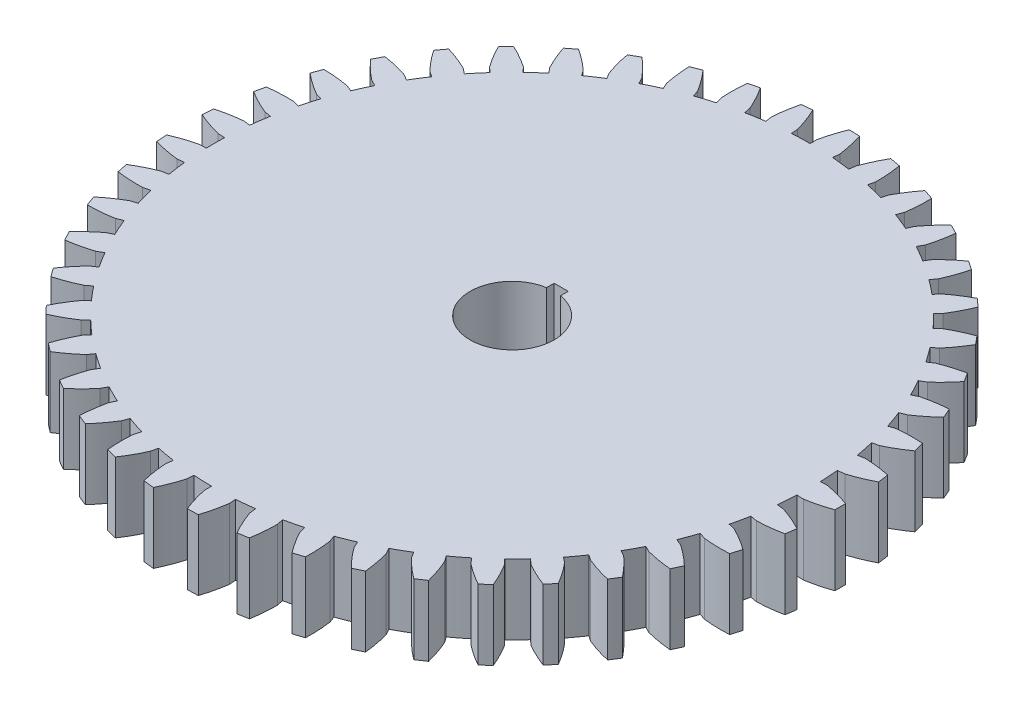
from build123d import *

# Parameters (mm, degrees)
BOSS_EXTRUDE1_DEPTH = 5
CIRPATTERN4_COUNT   = 45
SKETCH6_R           = 21.25
BOSS_EXTRUDE2_DEPTH = 5
SKETCH7_R           = 3
SKETCH7_W           = 1
SKETCH7_H           = 1
CUT_EXTRUDE1_DEPTH  = 34.606348303


with BuildPart() as part:
    # Sketch3 → Boss-Extrude1 (new body)
    with BuildSketch(Plane(origin=(0, 0, 0), x_dir=(1, 0, 0), z_dir=(0, 1, 0))):
        with BuildLine():
            Line((1.703017345, 21.666504385), (1.665143664, 21.184659463))
            ThreePointArc((1.665143664, 21.184659463), (0.833212579, 21.233658582), (0, 21.25))
            Line((0, 21.25), (0, 21.733331092))
            ThreePointArc((0, 21.733331092), (0.231941932, 22.625135128), (0.539377818, 23.493809218))
            ThreePointArc((0.539377818, 23.493809218), (0.921435088, 23.481928315), (1.303248573, 23.463834792))
            ThreePointArc((1.303248573, 23.463834792), (1.541670098, 22.573741159), (1.703017345, 21.666504385))
        make_face()
    extrude(amount=BOSS_EXTRUDE1_DEPTH)


with BuildPart() as cirpattern4_1:
    # CirPattern4: pattern copy
    add(part.part.rotate(Axis((0, 0, 0), (0, 1, 0)), 1 * 360 / CIRPATTERN4_COUNT))


with BuildPart() as cirpattern4_2:
    # CirPattern4: pattern copy
    add(part.part.rotate(Axis((0, 0, 0), (0, 1, 0)), 2 * 360 / CIRPATTERN4_COUNT))


with BuildPart() as cirpattern4_3:
    # CirPattern4: pattern copy
    add(part.part.rotate(Axis((0, 0, 0), (0, 1, 0)), 3 * 360 / CIRPATTERN4_COUNT))


with BuildPart() as cirpattern4_4:
    # CirPattern4: pattern copy
    add(part.part.rotate(Axis((0, 0, 0), (0, 1, 0)), 4 * 360 / CIRPATTERN4_COUNT))


with BuildPart() as cirpattern4_5:
    # CirPattern4: pattern copy
    add(part.part.rotate(Axis((0, 0, 0), (0, 1, 0)), 5 * 360 / CIRPATTERN4_COUNT))


with BuildPart() as cirpattern4_6:
    # CirPattern4: pattern copy
    add(part.part.rotate(Axis((0, 0, 0), (0, 1, 0)), 6 * 360 / CIRPATTERN4_COUNT))


with BuildPart() as cirpattern4_7:
    # CirPattern4: pattern copy
    add(part.part.rotate(Axis((0, 0, 0), (0, 1, 0)), 7 * 360 / CIRPATTERN4_COUNT))


with BuildPart() as cirpattern4_8:
    # CirPattern4: pattern copy
    add(part.part.rotate(Axis((0, 0, 0), (0, 1, 0)), 8 * 360 / CIRPATTERN4_COUNT))


with BuildPart() as cirpattern4_9:
    # CirPattern4: pattern copy
    add(part.part.rotate(Axis((0, 0, 0), (0, 1, 0)), 9 * 360 / CIRPATTERN4_COUNT))


with BuildPart() as cirpattern4_10:
    # CirPattern4: pattern copy
    add(part.part.rotate(Axis((0, 0, 0), (0, 1, 0)), 10 * 360 / CIRPATTERN4_COUNT))


with BuildPart() as cirpattern4_11:
    # CirPattern4: pattern copy
    add(part.part.rotate(Axis((0, 0, 0), (0, 1, 0)), 11 * 360 / CIRPATTERN4_COUNT))


with BuildPart() as cirpattern4_12:
    # CirPattern4: pattern copy
    add(part.part.rotate(Axis((0, 0, 0), (0, 1, 0)), 12 * 360 / CIRPATTERN4_COUNT))


with BuildPart() as cirpattern4_13:
    # CirPattern4: pattern copy
    add(part.part.rotate(Axis((0, 0, 0), (0, 1, 0)), 13 * 360 / CIRPATTERN4_COUNT))


with BuildPart() as cirpattern4_14:
    # CirPattern4: pattern copy
    add(part.part.rotate(Axis((0, 0, 0), (0, 1, 0)), 14 * 360 / CIRPATTERN4_COUNT))


with BuildPart() as cirpattern4_15:
    # CirPattern4: pattern copy
    add(part.part.rotate(Axis((0, 0, 0), (0, 1, 0)), 15 * 360 / CIRPATTERN4_COUNT))


with BuildPart() as cirpattern4_16:
    # CirPattern4: pattern copy
    add(part.part.rotate(Axis((0, 0, 0), (0, 1, 0)), 16 * 360 / CIRPATTERN4_COUNT))


with BuildPart() as cirpattern4_17:
    # CirPattern4: pattern copy
    add(part.part.rotate(Axis((0, 0, 0), (0, 1, 0)), 17 * 360 / CIRPATTERN4_COUNT))


with BuildPart() as cirpattern4_18:
    # CirPattern4: pattern copy
    add(part.part.rotate(Axis((0, 0, 0), (0, 1, 0)), 18 * 360 / CIRPATTERN4_COUNT))


with BuildPart() as cirpattern4_19:
    # CirPattern4: pattern copy
    add(part.part.rotate(Axis((0, 0, 0), (0, 1, 0)), 19 * 360 / CIRPATTERN4_COUNT))


with BuildPart() as cirpattern4_20:
    # CirPattern4: pattern copy
    add(part.part.rotate(Axis((0, 0, 0), (0, 1, 0)), 20 * 360 / CIRPATTERN4_COUNT))


with BuildPart() as cirpattern4_21:
    # CirPattern4: pattern copy
    add(part.part.rotate(Axis((0, 0, 0), (0, 1, 0)), 21 * 360 / CIRPATTERN4_COUNT))


with BuildPart() as cirpattern4_22:
    # CirPattern4: pattern copy
    add(part.part.rotate(Axis((0, 0, 0), (0, 1, 0)), 22 * 360 / CIRPATTERN4_COUNT))


with BuildPart() as cirpattern4_23:
    # CirPattern4: pattern copy
    add(part.part.rotate(Axis((0, 0, 0), (0, 1, 0)), 23 * 360 / CIRPATTERN4_COUNT))


with BuildPart() as cirpattern4_24:
    # CirPattern4: pattern copy
    add(part.part.rotate(Axis((0, 0, 0), (0, 1, 0)), 24 * 360 / CIRPATTERN4_COUNT))


with BuildPart() as cirpattern4_25:
    # CirPattern4: pattern copy
    add(part.part.rotate(Axis((0, 0, 0), (0, 1, 0)), 25 * 360 / CIRPATTERN4_COUNT))


with BuildPart() as cirpattern4_26:
    # CirPattern4: pattern copy
    add(part.part.rotate(Axis((0, 0, 0), (0, 1, 0)), 26 * 360 / CIRPATTERN4_COUNT))


with BuildPart() as cirpattern4_27:
    # CirPattern4: pattern copy
    add(part.part.rotate(Axis((0, 0, 0), (0, 1, 0)), 27 * 360 / CIRPATTERN4_COUNT))


with BuildPart() as cirpattern4_28:
    # CirPattern4: pattern copy
    add(part.part.rotate(Axis((0, 0, 0), (0, 1, 0)), 28 * 360 / CIRPATTERN4_COUNT))


with BuildPart() as cirpattern4_29:
    # CirPattern4: pattern copy
    add(part.part.rotate(Axis((0, 0, 0), (0, 1, 0)), 29 * 360 / CIRPATTERN4_COUNT))


with BuildPart() as cirpattern4_30:
    # CirPattern4: pattern copy
    add(part.part.rotate(Axis((0, 0, 0), (0, 1, 0)), 30 * 360 / CIRPATTERN4_COUNT))


with BuildPart() as cirpattern4_31:
    # CirPattern4: pattern copy
    add(part.part.rotate(Axis((0, 0, 0), (0, 1, 0)), 31 * 360 / CIRPATTERN4_COUNT))


with BuildPart() as cirpattern4_32:
    # CirPattern4: pattern copy
    add(part.part.rotate(Axis((0, 0, 0), (0, 1, 0)), 32 * 360 / CIRPATTERN4_COUNT))


with BuildPart() as cirpattern4_33:
    # CirPattern4: pattern copy
    add(part.part.rotate(Axis((0, 0, 0), (0, 1, 0)), 33 * 360 / CIRPATTERN4_COUNT))


with BuildPart() as cirpattern4_34:
    # CirPattern4: pattern copy
    add(part.part.rotate(Axis((0, 0, 0), (0, 1, 0)), 34 * 360 / CIRPATTERN4_COUNT))


with BuildPart() as cirpattern4_35:
    # CirPattern4: pattern copy
    add(part.part.rotate(Axis((0, 0, 0), (0, 1, 0)), 35 * 360 / CIRPATTERN4_COUNT))


with BuildPart() as cirpattern4_36:
    # CirPattern4: pattern copy
    add(part.part.rotate(Axis((0, 0, 0), (0, 1, 0)), 36 * 360 / CIRPATTERN4_COUNT))


with BuildPart() as cirpattern4_37:
    # CirPattern4: pattern copy
    add(part.part.rotate(Axis((0, 0, 0), (0, 1, 0)), 37 * 360 / CIRPATTERN4_COUNT))


with BuildPart() as cirpattern4_38:
    # CirPattern4: pattern copy
    add(part.part.rotate(Axis((0, 0, 0), (0, 1, 0)), 38 * 360 / CIRPATTERN4_COUNT))


with BuildPart() as cirpattern4_39:
    # CirPattern4: pattern copy
    add(part.part.rotate(Axis((0, 0, 0), (0, 1, 0)), 39 * 360 / CIRPATTERN4_COUNT))


with BuildPart() as cirpattern4_40:
    # CirPattern4: pattern copy
    add(part.part.rotate(Axis((0, 0, 0), (0, 1, 0)), 40 * 360 / CIRPATTERN4_COUNT))


with BuildPart() as cirpattern4_41:
    # CirPattern4: pattern copy
    add(part.part.rotate(Axis((0, 0, 0), (0, 1, 0)), 41 * 360 / CIRPATTERN4_COUNT))


with BuildPart() as cirpattern4_42:
    # CirPattern4: pattern copy
    add(part.part.rotate(Axis((0, 0, 0), (0, 1, 0)), 42 * 360 / CIRPATTERN4_COUNT))


with BuildPart() as cirpattern4_43:
    # CirPattern4: pattern copy
    add(part.part.rotate(Axis((0, 0, 0), (0, 1, 0)), 43 * 360 / CIRPATTERN4_COUNT))


with BuildPart() as cirpattern4_44:
    # CirPattern4: pattern copy
    add(part.part.rotate(Axis((0, 0, 0), (0, 1, 0)), 44 * 360 / CIRPATTERN4_COUNT))


with BuildPart() as part_1:
    add(part.part)

    add(cirpattern4_1.part)  # Boss-Extrude2 merges CirPattern4_1

    add(cirpattern4_2.part)  # Boss-Extrude2 merges CirPattern4_2

    add(cirpattern4_3.part)  # Boss-Extrude2 merges CirPattern4_3

    add(cirpattern4_4.part)  # Boss-Extrude2 merges CirPattern4_4

    add(cirpattern4_5.part)  # Boss-Extrude2 merges CirPattern4_5

    add(cirpattern4_6.part)  # Boss-Extrude2 merges CirPattern4_6

    add(cirpattern4_7.part)  # Boss-Extrude2 merges CirPattern4_7

    add(cirpattern4_8.part)  # Boss-Extrude2 merges CirPattern4_8

    add(cirpattern4_9.part)  # Boss-Extrude2 merges CirPattern4_9

    add(cirpattern4_10.part)  # Boss-Extrude2 merges CirPattern4_10

    add(cirpattern4_11.part)  # Boss-Extrude2 merges CirPattern4_11

    add(cirpattern4_12.part)  # Boss-Extrude2 merges CirPattern4_12

    add(cirpattern4_13.part)  # Boss-Extrude2 merges CirPattern4_13

    add(cirpattern4_14.part)  # Boss-Extrude2 merges CirPattern4_14

    add(cirpattern4_15.part)  # Boss-Extrude2 merges CirPattern4_15

    add(cirpattern4_16.part)  # Boss-Extrude2 merges CirPattern4_16

    add(cirpattern4_17.part)  # Boss-Extrude2 merges CirPattern4_17

    add(cirpattern4_18.part)  # Boss-Extrude2 merges CirPattern4_18

    add(cirpattern4_19.part)  # Boss-Extrude2 merges CirPattern4_19

    add(cirpattern4_20.part)  # Boss-Extrude2 merges CirPattern4_20

    add(cirpattern4_21.part)  # Boss-Extrude2 merges CirPattern4_21

    add(cirpattern4_22.part)  # Boss-Extrude2 merges CirPattern4_22

    add(cirpattern4_23.part)  # Boss-Extrude2 merges CirPattern4_23

    add(cirpattern4_24.part)  # Boss-Extrude2 merges CirPattern4_24

    add(cirpattern4_25.part)  # Boss-Extrude2 merges CirPattern4_25

    add(cirpattern4_26.part)  # Boss-Extrude2 merges CirPattern4_26

    add(cirpattern4_27.part)  # Boss-Extrude2 merges CirPattern4_27

    add(cirpattern4_28.part)  # Boss-Extrude2 merges CirPattern4_28

    add(cirpattern4_29.part)  # Boss-Extrude2 merges CirPattern4_29

    add(cirpattern4_30.part)  # Boss-Extrude2 merges CirPattern4_30

    add(cirpattern4_31.part)  # Boss-Extrude2 merges CirPattern4_31

    add(cirpattern4_32.part)  # Boss-Extrude2 merges CirPattern4_32

    add(cirpattern4_33.part)  # Boss-Extrude2 merges CirPattern4_33

    add(cirpattern4_34.part)  # Boss-Extrude2 merges CirPattern4_34

    add(cirpattern4_35.part)  # Boss-Extrude2 merges CirPattern4_35

    add(cirpattern4_36.part)  # Boss-Extrude2 merges CirPattern4_36

    add(cirpattern4_37.part)  # Boss-Extrude2 merges CirPattern4_37

    add(cirpattern4_38.part)  # Boss-Extrude2 merges CirPattern4_38

    add(cirpattern4_39.part)  # Boss-Extrude2 merges CirPattern4_39

    add(cirpattern4_40.part)  # Boss-Extrude2 merges CirPattern4_40

    add(cirpattern4_41.part)  # Boss-Extrude2 merges CirPattern4_41

    add(cirpattern4_42.part)  # Boss-Extrude2 merges CirPattern4_42

    add(cirpattern4_43.part)  # Boss-Extrude2 merges CirPattern4_43

    add(cirpattern4_44.part)  # Boss-Extrude2 merges CirPattern4_44
    # Sketch6 → Boss-Extrude2 (add)
    with BuildSketch(Plane(origin=(0, 0, 0), x_dir=(1, 0, 0), z_dir=(0, 1, 0))):
        Circle(SKETCH6_R)
    extrude(amount=BOSS_EXTRUDE2_DEPTH)

    # Sketch7 → Cut-Extrude1 (cut, through all)
    with BuildSketch(Plane(origin=(0, 5, 0), x_dir=(1, 0, 0), z_dir=(0, 1, 0))):
        Circle(SKETCH7_R)
        with Locations((0, 3)):
            Rectangle(SKETCH7_W, SKETCH7_H)
    extrude(amount=-CUT_EXTRUDE1_DEPTH, mode=Mode.SUBTRACT)


solid = part_1.part
